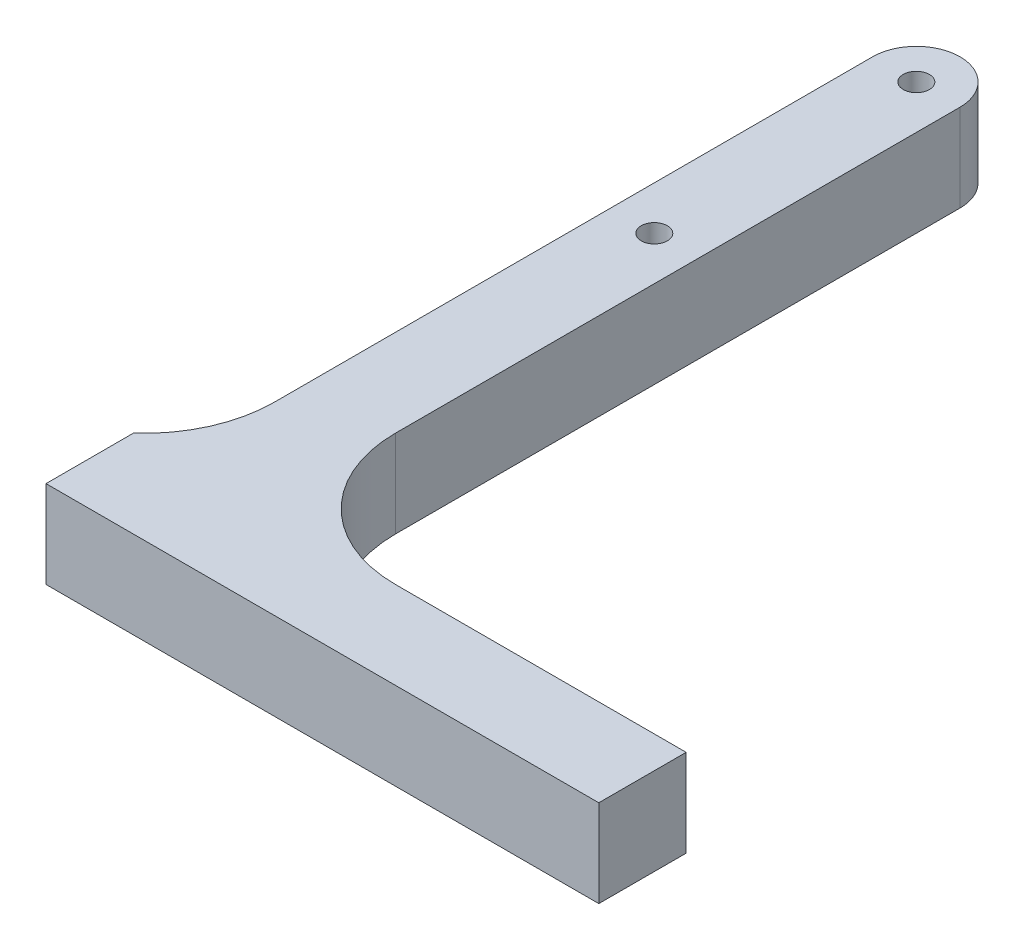
from build123d import *

# Parameters (mm, degrees)
BOSS_EXTRUDE1_DEPTH = 10
SKETCH2_R           = 1.5
CUT_EXTRUDE1_DEPTH  = 112.585820336
BOSS_EXTRUDE2_DEPTH = 0.5
SKETCH5_R           = 3.25
CUT_EXTRUDE2_DEPTH  = 5
FILLET1_R           = 15


with BuildPart() as part:
    # Sketch1 → Boss-Extrude1 (new body)
    with BuildSketch(Plane(origin=(0, 0, 0), x_dir=(1, 0, 0), z_dir=(0, 1, 0))):
        with BuildLine():
            Line((0, 0), (10, 0))
            Line((10, 0), (58.28, 0))
            Line((58.28, 0), (58.28, 10))
            Line((58.28, 10), (10, 10))
            Line((10, 10), (10, 89.63))
            ThreePointArc((10, 89.63), (5, 94.63), (0, 89.63))
            Line((0, 89.63), (0, 10))
            Line((0, 10), (-5, 10))
            Line((-5, 10), (-5, 0))
            Line((-5, 0), (0, 0))
        make_face()
    extrude(amount=BOSS_EXTRUDE1_DEPTH)

    # Sketch2 → Cut-Extrude1 (cut, through all)
    with BuildSketch(Plane(origin=(0, 10, 0), x_dir=(1, 0, 0), z_dir=(0, 1, 0))):
        with Locations(Location((5, 89.63, 0), (0, 0, 270))):
            Circle(SKETCH2_R)
        with Locations(Location((5, 59.63, 0), (0, 0, 270))):
            Circle(SKETCH2_R)
    extrude(amount=-CUT_EXTRUDE1_DEPTH, mode=Mode.SUBTRACT)

    # Sketch4 → Boss-Extrude2 (add)
    with BuildSketch(Plane(origin=(0, 10, 0), x_dir=(1, 0, 0), z_dir=(0, 1, 0))):
        with BuildLine():
            Line((7.461538462, 41.930004151), (5.788461538, 41.930004151))
            add(Edge.make_bspline(
                [(5.788461538, 41.930004151), (5.677871663, 41.92961162), (5.465176181, 41.928856674), (5.158480914, 41.916945611), (4.876739133, 41.900370391), (4.619533695, 41.875076164), (4.386974636, 41.841539077), (4.178828878, 41.802004401), (3.995102505, 41.756946162), (3.834246039, 41.700800041), (3.689081032, 41.637468067), (3.553767063, 41.564698468), (3.425318906, 41.483301557), (3.304595098, 41.391135559), (3.19054652, 41.289858519), (3.082958012, 41.179368492), (2.983349901, 41.058728567), (2.892338963, 40.928701036), (2.809389819, 40.791915054), (2.736080173, 40.648182815), (2.676464647, 40.497404362), (2.62378794, 40.341758769), (2.585846614, 40.179021052), (2.559458976, 40.010775491), (2.540138981, 39.836429843), (2.539028173, 39.71798715), (2.538461538, 39.657568254)],
                knots=[0, 0, 0, 0, 1.749336639, 3.364467119, 4.854658419, 6.213483162, 7.451590619, 8.570285859, 9.5643256, 10.440900261, 11.26203566, 12.067320669, 12.869050712, 13.665104639, 14.467235401, 15.27997916, 16.102287765, 16.939272006, 17.78853747, 18.631303466, 19.488103222, 20.351255419, 21.228522269, 22.127379805, 23.044756219, 24, 24, 24, 24], degree=3))
            add(Edge.make_bspline(
                [(2.538461538, 39.657568254), (2.539933452, 39.594504805), (2.542819606, 39.470848877), (2.558366003, 39.289208404), (2.586779932, 39.115427505), (2.629816962, 38.950014988), (2.679282438, 38.790912103), (2.745058832, 38.641054396), (2.819293994, 38.498262405), (2.907460927, 38.364555977), (3.004219829, 38.236965223), (3.116748396, 38.120378621), (3.237756507, 38.008530081), (3.374046466, 37.908425416), (3.519610488, 37.81329591), (3.677340774, 37.727083244), (3.846207924, 37.64762023), (3.964929894, 37.603306164), (4.025641026, 37.580645177)],
                knots=[0, 0, 0, 0, 1.099860209, 2.156625411, 3.176576793, 4.16617041, 5.135385252, 6.078461593, 7.016046972, 7.938469504, 8.868247731, 9.803980173, 10.76021508, 11.73834243, 12.748633912, 13.790971185, 14.870363756, 16, 16, 16, 16], degree=3))
            Line((4.025641026, 37.580645177), (2.179487179, 33.930004151))
            Line((2.179487179, 33.930004151), (3.775641026, 33.930004151))
            Line((3.775641026, 33.930004151), (5.538461538, 37.417183638))
            Line((5.538461538, 37.417183638), (6.025641026, 37.417183638))
            Line((6.025641026, 37.417183638), (6.025641026, 33.930004151))
            Line((6.025641026, 33.930004151), (7.461538462, 33.930004151))
            Line((7.461538462, 33.930004151), (7.461538462, 41.930004151))
        make_face()
        with BuildLine():
            Line((6.025641026, 38.853081074), (5.466346154, 38.853081074))
            add(Edge.make_bspline(
                [(5.466346154, 38.853081074), (5.397967707, 38.853851198), (5.267037673, 38.85532582), (5.078743088, 38.862165728), (4.907726699, 38.878646528), (4.753254104, 38.899469401), (4.61454801, 38.923512416), (4.492845628, 38.957967516), (4.386271709, 38.994887028), (4.296089158, 39.040768404), (4.219039259, 39.092945479), (4.152511603, 39.152219935), (4.097483692, 39.220822569), (4.052192915, 39.296889059), (4.016961614, 39.381092194), (3.991245464, 39.472507614), (3.976873938, 39.572176658), (3.975220446, 39.64096187), (3.974358974, 39.676799023)],
                knots=[0, 0, 0, 0, 1.688639943, 3.233382647, 4.650958383, 5.928841754, 7.082724185, 8.122798841, 9.049171256, 9.863274652, 10.613301712, 11.341792392, 12.054588806, 12.776240173, 13.521029143, 14.301969904, 15.115324896, 16, 16, 16, 16], degree=3))
            add(Edge.make_bspline(
                [(3.974358974, 39.676799023), (3.975987665, 39.719196991), (3.979186925, 39.802479943), (4.010933525, 39.922378191), (4.061467254, 40.033352223), (4.130735157, 40.134900631), (4.217969074, 40.223924975), (4.318076877, 40.302400643), (4.433219134, 40.36445333), (4.539832198, 40.405382621), (4.636825167, 40.429871039), (4.724358262, 40.448119591), (4.825722112, 40.461052863), (4.940993243, 40.474770901), (5.069877824, 40.483666354), (5.213078352, 40.490158262), (5.370183559, 40.49281442), (5.479700808, 40.493663547), (5.536858974, 40.494106715)],
                knots=[0, 0, 0, 0, 1.020303359, 2.004196876, 2.966617323, 3.9489082, 4.950758222, 5.960522915, 7.003732012, 8.091992268, 8.70421221, 9.413913587, 10.24622431, 11.166358409, 12.212345909, 13.359657661, 14.621978493, 16, 16, 16, 16], degree=3))
            Line((5.536858974, 40.494106715), (6.025641026, 40.494106715))
            Line((6.025641026, 40.494106715), (6.025641026, 38.853081074))
        make_face(mode=Mode.SUBTRACT)
    extrude(amount=BOSS_EXTRUDE2_DEPTH)

    # Sketch5 → Cut-Extrude2 (cut)
    with BuildSketch(Plane(origin=(0, 10, 0), x_dir=(1, 0, 0), z_dir=(0, 1, 0))):
        with Locations(Location((5, 89.63, 0), (0, 0, 270))):
            Circle(SKETCH5_R)
        with Locations(Location((5, 59.63, 0), (0, 0, 270))):
            Circle(SKETCH5_R)
    extrude(amount=-CUT_EXTRUDE2_DEPTH, mode=Mode.SUBTRACT)


with BuildPart() as body_2:
    # Mirror1: mirrored copy
    add(part.part.mirror(Plane.ZX))

    # Fillet1
    # the kernel refuses this fillet: 15 mm, written as the material it adds along each edge
    with BuildSketch(Plane(origin=(0, 0, -10), x_dir=(-1, 0, 0), z_dir=(0, -1, 0))) as fillet1_piece_1:
        with BuildLine():
            CenterArc((15, 11.180339887), FILLET1_R, 180, 48.189685104)
            Line((0, 11.180339887), (-0.3, 11.180339887))
            Line((-0.3, 11.180339887), (-0.3, 0))
            Line((-0.3, 0), (0, -0.3))
            ThreePointArc((0, -0.3), (2.5, -0.3), (4.8, -0.223606798))
            Line((4.8, -0.223606798), (5, 0))
        make_face()
    extrude(amount=10)
    with BuildSketch(Plane(origin=(10, 0, -10), x_dir=(1, 0, 0), z_dir=(0, -1, 0))) as fillet1_piece_2:
        with BuildLine():
            CenterArc((FILLET1_R, -FILLET1_R), FILLET1_R, 90, 90)
            Line((0, -FILLET1_R), (-FILLET1_R * 0.02, -FILLET1_R))
            Line((-FILLET1_R * 0.02, -FILLET1_R), (-FILLET1_R * 0.02, FILLET1_R * 0.02))
            Line((-FILLET1_R * 0.02, FILLET1_R * 0.02), (FILLET1_R, FILLET1_R * 0.02))
            Line((FILLET1_R, FILLET1_R * 0.02), (FILLET1_R, 0))
        make_face()
    extrude(amount=10)


solid = body_2.part
